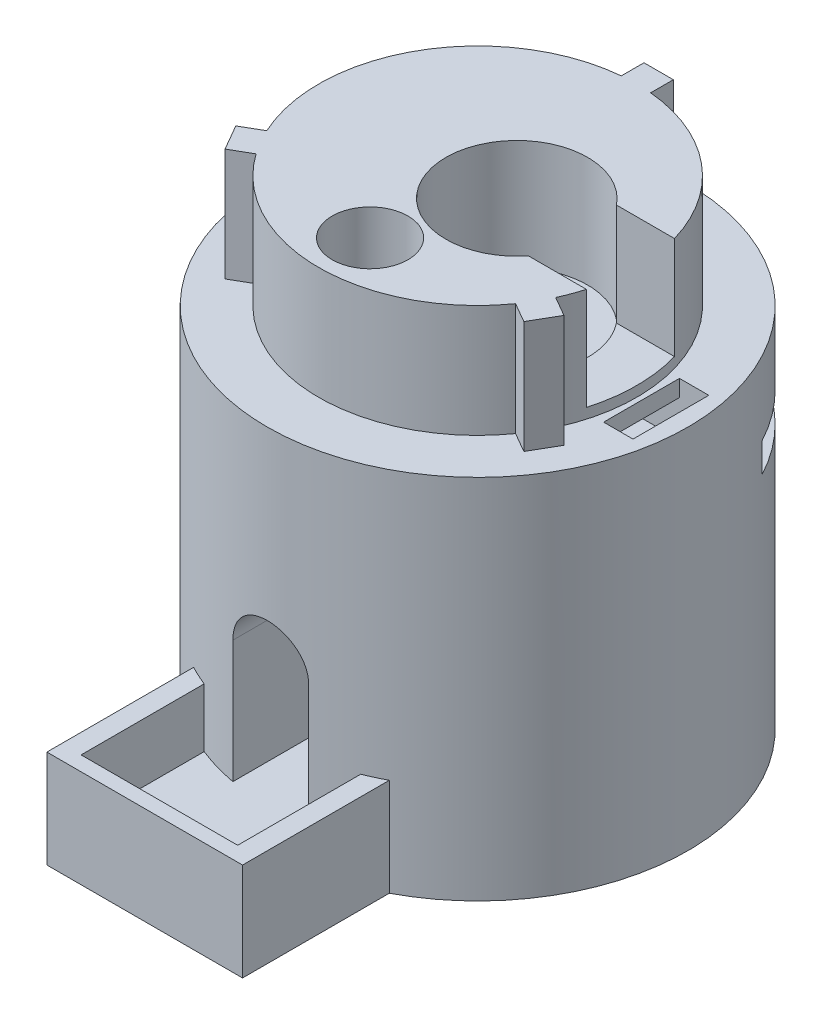
from build123d import *
from build123d.topology import SkipClean

# Parameters (mm, degrees)
SKETCH2_R                = 43
BOSS_EXTRUDE1_DEPTH      = 75
BOSS_EXTRUDE2_DEPTH      = 23
SKETCH4_R                = 14.5
CUT_EXTRUDE2_DEPTH       = 22.6
CUT_EXTRUDE3_START       = -20.9
CUT_EXTRUDE3_DEPTH       = 20.9
CUT_EXTRUDE6_START       = 4
CUT_EXTRUDE6_DEPTH       = 56
CUT_EXTRUDE6_START_2     = 54
CUT_EXTRUDE6_2_DEPTH     = 6
SKETCH8_W                = 6
SKETCH8_H                = 15.5
CUT_EXTRUDE7_DEPTH       = 13
SKETCH10_W               = 15.5
SKETCH10_H               = 7.5
CUT_EXTRUDE8_DEPTH       = 25
SKETCH12_W               = 10
SKETCH12_H               = 15.5
CUT_EXTRUDE9_DEPTH       = 8
SKETCH7_R                = 7.75
CUT_EXTRUDE10_DEPTH      = 90
BOSS_EXTRUDE3_DEPTH      = 20
CUT_EXTRUDE11_REACH      = 156.236
CUT_EXTRUDE12_REACH      = 156.236
CUT_EXTRUDE12_END_RADIUS = 43
SKETCH16_W               = 32
SKETCH16_H               = 12
SKETCH17_W               = 40
SKETCH17_H               = 20
BOSS_EXTRUDE4_DEPTH      = 3


# Read off the part's stored shape, not the designer's step: Cut-Extrude6
with BuildPart() as part:
    # Sketch2 → Boss-Extrude1 (new body)
    with BuildSketch(Plane(origin=(0, 0, 0), x_dir=(1, 0, 0), z_dir=(0, 1, 0))):
        with Locations(Location((0, 0, 0), (0, 0, 270))):
            Circle(SKETCH2_R)
    extrude(amount=BOSS_EXTRUDE1_DEPTH)

    # Sketch3 → Boss-Extrude2 (add)
    with BuildSketch(Plane(origin=(0, 75, 0), x_dir=(1, 0, 0), z_dir=(0, 1, 0))):
        with BuildLine():
            Line((-3, 32.361242251), (-3, 37))
            Line((-3, 37), (3, 37))
            Line((3, 37), (3, 32.361242251))
            ThreePointArc((3, 32.361242251), (28.145825623, 16.25), (29.525657887, -13.582544914))
            Line((29.525657887, -13.582544914), (33.54293994, -15.901923789))
            Line((33.54293994, -15.901923789), (30.54293994, -21.098076211))
            Line((30.54293994, -21.098076211), (26.525657887, -18.778697337))
            ThreePointArc((26.525657887, -18.778697337), (0, -32.5), (-26.525657887, -18.778697337))
            Line((-26.525657887, -18.778697337), (-30.54293994, -21.098076211))
            Line((-30.54293994, -21.098076211), (-33.54293994, -15.901923789))
            Line((-33.54293994, -15.901923789), (-29.525657887, -13.582544914))
            ThreePointArc((-29.525657887, -13.582544914), (-28.145825623, 16.25), (-3, 32.361242251))
        make_face()
    extrude(amount=BOSS_EXTRUDE2_DEPTH)

    # Sketch4 → Cut-Extrude2 (cut)
    with BuildSketch(Plane(origin=(0, 98, 0), x_dir=(1, 0, 0), z_dir=(0, 1, 0))):
        with Locations(Location((8, 0, 0), (0, 0, 270))):
            Circle(SKETCH4_R)
    extrude(amount=-CUT_EXTRUDE2_DEPTH, mode=Mode.SUBTRACT)

    # Sketch5 → Cut-Extrude3 (cut)
    with BuildSketch(Plane(origin=(0, 98, 0), x_dir=(1, 0, 0), z_dir=(0, 1, 0)).offset(CUT_EXTRUDE3_START)):
        with BuildLine():
            Line((19.368817001, 9), (31.228992939, 9))
            ThreePointArc((31.228992939, 9), (32.5, 0), (31.228992939, -9))
            Line((31.228992939, -9), (19.368817001, -9))
            ThreePointArc((19.368817001, -9), (22.5, 0), (19.368817001, 9))
        make_face()
    extrude(amount=CUT_EXTRUDE3_DEPTH, mode=Mode.SUBTRACT)

    # Cut-Extrude6 outline → Cut-Extrude6 (cut)
    with BuildSketch(Plane(origin=(0, 0, 0), x_dir=(1, 0, 0), z_dir=(0, 1, 0)).offset(CUT_EXTRUDE6_START)):
        with BuildLine():
            Line((-25, 34.985711369), (-25, -8))
            Line((-25, -8), (25, -8))
            Line((25, -8), (25, 34.985711369))
            ThreePointArc((25, 34.985711369), (0, 43), (-25, 34.985711369))
        make_face()
    extrude(amount=CUT_EXTRUDE6_DEPTH, mode=Mode.SUBTRACT)

    # Cut-Extrude6 2 outline → Cut-Extrude6 2 (cut)
    with BuildSketch(Plane(origin=(0, 0, 0), x_dir=(1, 0, 0), z_dir=(0, 1, 0)).offset(CUT_EXTRUDE6_START_2)):
        with BuildLine():
            Line((-38, 20.124611797), (-38, -8))
            Line((-38, -8), (-25, -8))
            Line((-25, -8), (-25, 34.985711369))
            ThreePointArc((-25, 34.985711369), (-32.36453414, 28.311427549), (-38, 20.124611797))
        make_face()
        with BuildLine():
            Line((25, 34.985711369), (25, -8))
            Line((25, -8), (38, -8))
            Line((38, -8), (38, 20.124611797))
            ThreePointArc((38, 20.124611797), (32.36453414, 28.311427549), (25, 34.985711369))
        make_face()
    extrude(amount=CUT_EXTRUDE6_2_DEPTH, mode=Mode.SUBTRACT)

    # Sketch8 → Cut-Extrude7 (cut)
    with BuildSketch(Plane(origin=(0, 77.1, 0), x_dir=(1, 0, 0), z_dir=(0, 1, 0))):
        with Locations((36.5, 0)):
            Rectangle(SKETCH8_W, SKETCH8_H)
    extrude(amount=-CUT_EXTRUDE7_DEPTH, mode=Mode.SUBTRACT)

    # Sketch10 → Cut-Extrude8 (cut)
    with BuildSketch(Plane(origin=(33.5, 0, 0), x_dir=(0, 0, -1), z_dir=(1, 0, 0))):
        with Locations((0, 67.85)):
            Rectangle(SKETCH10_W, SKETCH10_H)
    extrude(amount=-CUT_EXTRUDE8_DEPTH, mode=Mode.SUBTRACT)

    # Sketch12 → Cut-Extrude9 (cut)
    with BuildSketch(Plane(origin=(0, 64.1, 0), x_dir=(1, 0, 0), z_dir=(0, 1, 0))):
        with Locations((13.5, 0)):
            Rectangle(SKETCH12_W, SKETCH12_H)
    extrude(amount=-CUT_EXTRUDE9_DEPTH, mode=Mode.SUBTRACT)

    # Sketch7 → Cut-Extrude10 (cut)
    with BuildSketch(Plane(origin=(0, 98, 0), x_dir=(1, 0, 0), z_dir=(0, 1, 0))):
        with Locations(Location((0, -22, 0), (0, 0, 270))):
            Circle(SKETCH7_R)
    extrude(amount=-CUT_EXTRUDE10_DEPTH, mode=Mode.SUBTRACT)

    # Sketch13 → Boss-Extrude3 (add)
    with BuildSketch(Plane.XZ):
        with BuildLine():
            Line((-20, 38.065732621), (-20, 68.065732621))
            Line((-20, 68.065732621), (20, 68.065732621))
            Line((20, 68.065732621), (20, 38.065732621))
            ThreePointArc((20, 38.065732621), (0, 43), (-20, 38.065732621))
        make_face()
    extrude(amount=-BOSS_EXTRUDE3_DEPTH)

    # Sketch14 → Cut-Extrude11 (cut, up to next)
    with BuildSketch(Plane.XY.offset(68.065732621), mode=Mode.PRIVATE) as cut_extrude11_sk1:
        with BuildLine():
            Line((-7.75, 8), (7.75, 8))
            Line((7.75, 8), (7.75, 33.050905548))
            ThreePointArc((7.75, 33.050905548), (0, 40.750167184), (-7.75, 33.050905548))
            Line((-7.75, 33.050905548), (-7.75, 8))
        make_face()
    cut_extrude11_tool1 = extrude(cut_extrude11_sk1.sketch, amount=-CUT_EXTRUDE11_REACH, mode=Mode.PRIVATE) & part.part
    add(cut_extrude11_tool1.solids().sort_by_distance((0, 23.591664, 68.065733))[0], mode=Mode.SUBTRACT)

    # Cut-Extrude12: up to this cylinder (the profile starts outside it)
    with SkipClean():  # the faces are left unmerged after this step: merging them gives an invalid solid
        cut_extrude12_end = Plane(origin=(0, 14, 0), z_dir=(0, -1, 0)) * Cylinder(CUT_EXTRUDE12_END_RADIUS, 399.472, mode=Mode.PRIVATE)
        # Sketch16 → Cut-Extrude12 (cut, up to the surface)
        with BuildSketch(Plane.XY.offset(68.065732621), mode=Mode.PRIVATE) as cut_extrude12_sk1:
            with Locations((0, 14)):
                Rectangle(SKETCH16_W, SKETCH16_H)
        cut_extrude12_tool1 = extrude(cut_extrude12_sk1.sketch, amount=-CUT_EXTRUDE12_REACH, mode=Mode.PRIVATE) - cut_extrude12_end
        add(cut_extrude12_tool1.solids().sort_by_distance((0, 14, 68.065733))[0], mode=Mode.SUBTRACT)

    # Sketch17 → Boss-Extrude4 (add)
    with SkipClean():  # the faces are left unmerged after this step: merging them gives an invalid solid
        with BuildSketch(Plane.XY.offset(68.065732621)):
            with Locations((0, 10)):
                Rectangle(SKETCH17_W, SKETCH17_H)
        extrude(amount=-BOSS_EXTRUDE4_DEPTH)


solid = part.part
